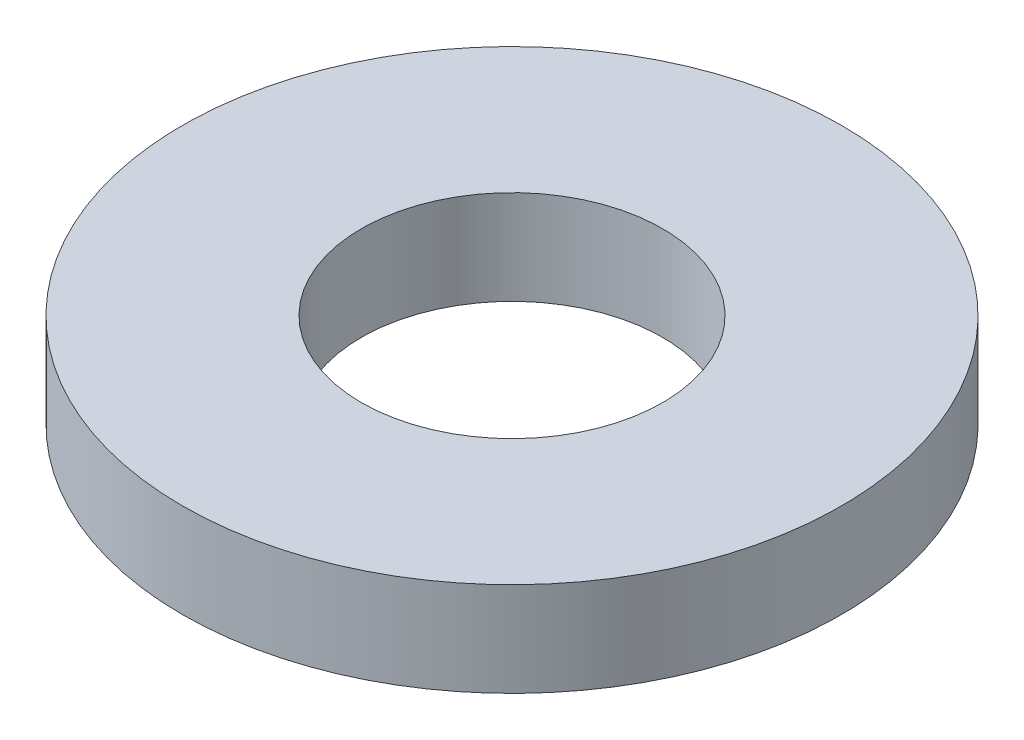
from build123d import *

# Parameters (mm, degrees)
SKETCH1_R           = 3.5
SKETCH1_R_2         = 1.6
BOSS_EXTRUDE1_DEPTH = 1


with BuildPart() as part:
    # Sketch1 → Boss-Extrude1 (new body)
    with BuildSketch(Plane(origin=(0, 0, 0), x_dir=(1, 0, 0), z_dir=(0, 1, 0))):
        Circle(SKETCH1_R)
        Circle(SKETCH1_R_2, mode=Mode.SUBTRACT)
    extrude(amount=BOSS_EXTRUDE1_DEPTH)


solid = part.part
